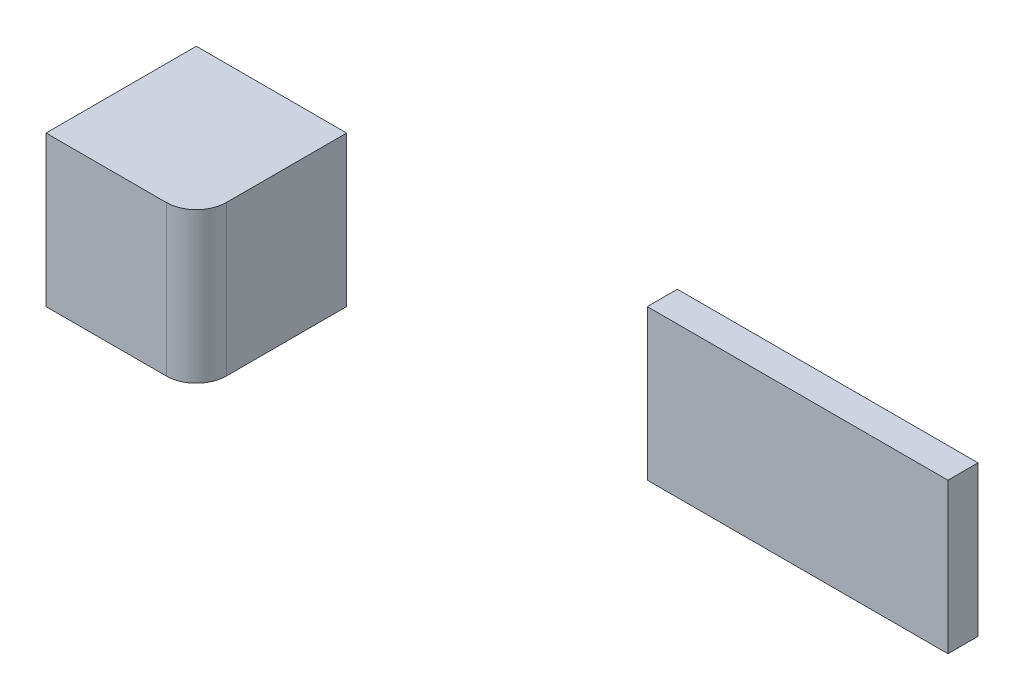
from build123d import *

# Parameters (mm, degrees)
SKETCH_1_W             = 10
SKETCH_1_H             = 10
EXTRUDE_1_DEPTH        = 10
FILLET_1_R             = 2
SKETCH_2_W             = 20
SKETCH_2_H             = 10
SM_BASE_FLANGE_1_DEPTH = 2


# Sheet-metal steps are written as plain solids
with BuildPart() as part:
    # Sketch 1 → 凸台-拉伸1 (new body)
    with BuildSketch(Plane.XY):
        with Locations((5, 5)):
            Rectangle(SKETCH_1_W, SKETCH_1_H)
    extrude(amount=EXTRUDE_1_DEPTH)

    # 圆角1
    fillet_1_edges = [part.edges().sort_by_distance(p)[0] for p in [
        (10, 5, 10),
    ]]
    fillet(fillet_1_edges, radius=FILLET_1_R)


with BuildPart() as body_2:
    # Sketch 2 → 基体-法兰1 (new body)
    with BuildSketch(Plane.XY):
        with Locations((40, 5)):
            Rectangle(SKETCH_2_W, SKETCH_2_H)
    extrude(amount=-SM_BASE_FLANGE_1_DEPTH)


solid = Compound([part.part, body_2.part])
